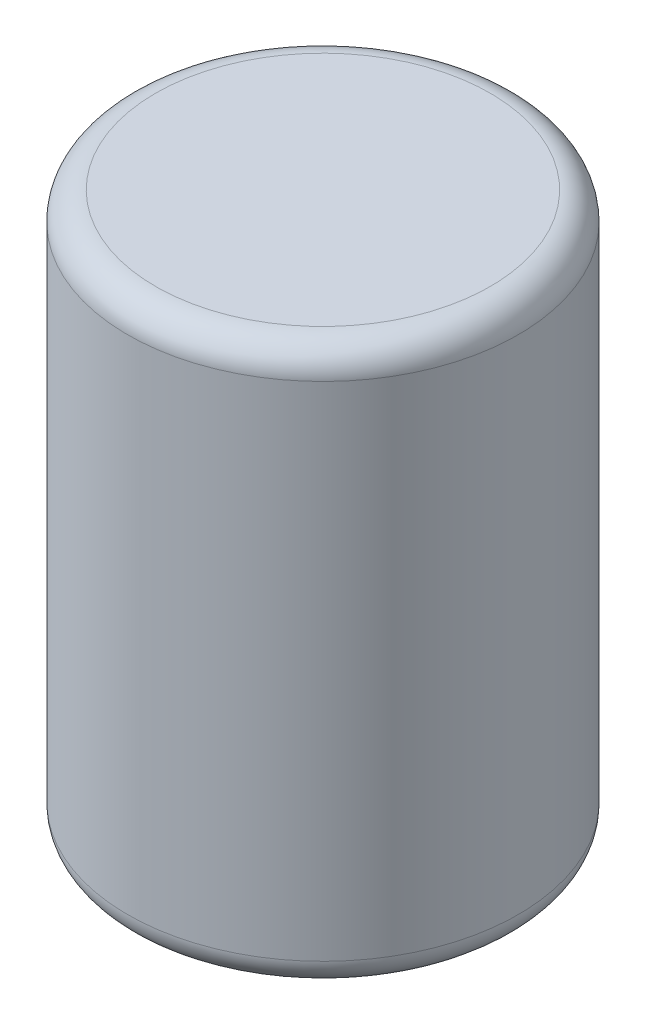
from build123d import *

# Parameters (mm, degrees)
THREAD1_PITCH = 1


with BuildPart() as part:
    # Sketch1 → Revolve1 (revolve)
    with BuildSketch(Plane.XY):
        with BuildLine():
            Line((-0.785577292, -6.256562003), (-2.785577292, -6.256562003))
            ThreePointArc((-2.785577292, -6.256562003), (-3.492684073, -5.963668785), (-3.785577292, -5.256562003))
            Line((-3.785577292, -5.256562003), (-3.785577292, 12.743437997))
            ThreePointArc((-3.785577292, 12.743437997), (-3.492684073, 13.450544778), (-2.785577292, 13.743437997))
            Line((-2.785577292, 13.743437997), (3.214422708, 13.743437997))
            Line((3.214422708, 13.743437997), (3.214422708, 3.743437997))
            Line((3.214422708, 3.743437997), (-0.785577292, 3.743437997))
            Line((-0.785577292, 3.743437997), (-0.785577292, -6.256562003))
        make_face()
    revolve(axis=Axis((3.214422708, 13.743437997, 0), (0, -1, 0)))

    # Thread1: the profile of Thread Profile1 profile screwed along a right-hand helix of 11 turns, 8 arcs to a turn; built about Z, then put on its axis
    thread1_z = Axis((0, 0, 0), (0, 0, 1))
    thread1_corners = [(4.0003, 0, -0.000173205), (4.0003, 0, 0.875173202), (3.458734125, 0, 0.562499998), (3.458734125, 0, 0.312499998)]
    with BuildLine(mode=Mode.PRIVATE) as thread1_profile:
        Line(thread1_corners[0], thread1_corners[1])
        Line(thread1_corners[1], thread1_corners[2])
        Line(thread1_corners[2], thread1_corners[3])
        Line(thread1_corners[3], thread1_corners[0])
    thread1_cap = Face(thread1_profile.wire())
    thread1_turn_angles = [0, 22.5, 45, 67.5, 90, 112.5, 135, 157.5, 180, 202.5, 225, 247.5, 270, 292.5, 315, 337.5, 360]
    thread1_turn_weights = [1, 0.9238795325112867, 1, 0.9238795325112867, 1, 0.9238795325112867, 1, 0.9238795325112867, 1, 0.9238795325112867, 1, 0.9238795325112867, 1, 0.9238795325112867, 1, 0.9238795325112867, 1]
    thread1_turn_rails = [Edge.make_bspline([Vector(p[0], p[1], 0).rotate(thread1_z, thread1_turn_angles[k]) / thread1_turn_weights[k] + Vector(0, 0, p[2] + THREAD1_PITCH * thread1_turn_angles[k] / 360) for k in range(17)], [0, 0, 0, 1, 1, 2, 2, 3, 3, 4, 4, 5, 5, 6, 6, 7, 7, 8, 8, 8], 2, thread1_turn_weights) for p in thread1_corners]
    thread1_turn_sides = [Face.make_surface_from_curves(thread1_turn_rails[p[0]], thread1_turn_rails[p[1]]) for p in [(0, 1), (1, 2), (2, 3), (3, 0)]]
    thread1 = Plane(origin=(3.214422708, -7.256562003, 0), x_dir=(1, 0, 0), z_dir=(0, 1, 0)) * Solid(Shell([*[p.moved(Location((0, 0, THREAD1_PITCH * i))) for i in range(11) for p in thread1_turn_sides], thread1_cap, thread1_cap.rotate(thread1_z, 3960).moved(Location((0, 0, THREAD1_PITCH * 3960 / 360)))]))
    add(thread1)

    # SurfaceCut1
    split(bisect_by=Plane(origin=(0, -6.256562003, 0), x_dir=(1, 0, 0), z_dir=(0, 1, 0)), keep=Keep.TOP)


solid = part.part
